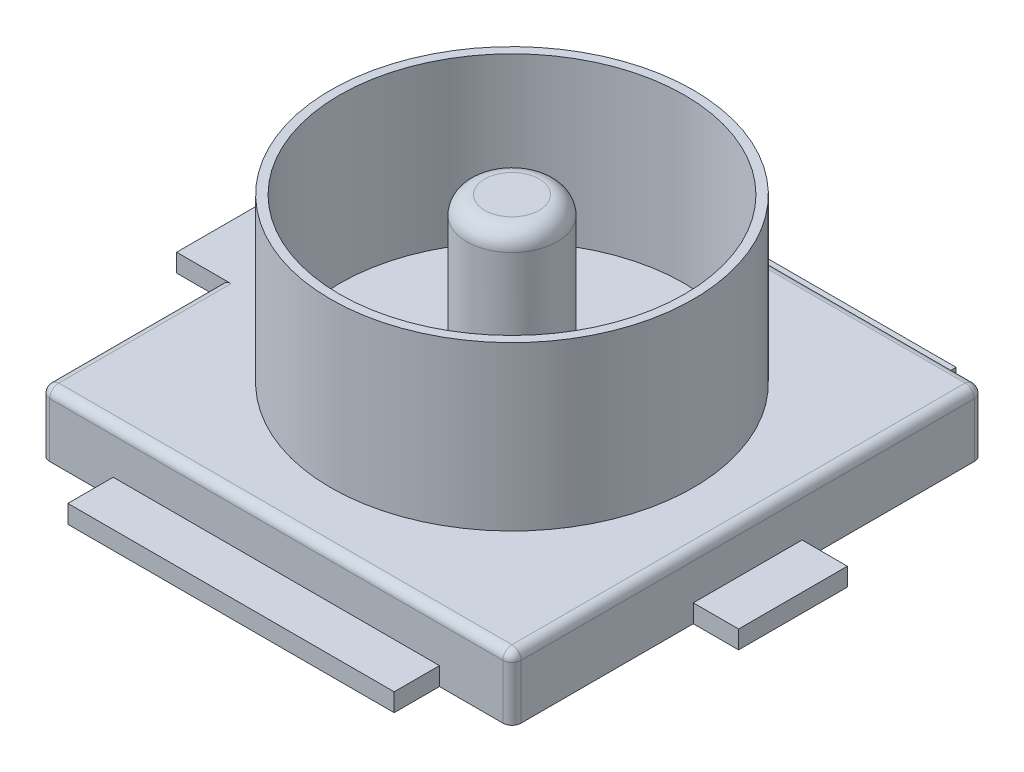
from build123d import *

# Parameters (mm, degrees)
SKETCH_1_W      = 2.6
SKETCH_1_H      = 2.6
EXTRUDE_1_DEPTH = 0.35
SKETCH_2_R      = 1
SKETCH_2_R_2    = 0.951541019
SKETCH_2_R_3    = 0.25
EXTRUDE_2_DEPTH = 0.9
SKETCH_3_W      = 0.6
SKETCH_3_H      = 0.1
EXTRUDE_3_DEPTH = 0.25
SKETCH_4_W      = 1.8
SKETCH_4_H      = 0.1
EXTRUDE_4_DEPTH = 0.25
SKETCH_5_W      = 1.8
SKETCH_5_H      = 0.1
EXTRUDE_5_DEPTH = 0.25
SKETCH_6_W      = 0.6
SKETCH_6_H      = 0.1
EXTRUDE_6_DEPTH = 0.25
FILLET_1_R      = 0.1
FILLET_2_R      = 0.05
FILLET_3_R      = 0.05


with BuildPart() as part:
    # 草图1 → 凸台-拉伸1 (new body)
    with BuildSketch(Plane(origin=(0, 0, 0), x_dir=(1, 0, 0), z_dir=(0, 1, 0))):
        with Locations((1.3, 1.3)):
            Rectangle(SKETCH_1_W, SKETCH_1_H)
    extrude(amount=EXTRUDE_1_DEPTH)

    # 草图2 → 凸台-拉伸2 (add)
    # profile 1 of 2: a face of its own
    with BuildSketch(Plane(origin=(0, 0.35, 0), x_dir=(1, 0, 0), z_dir=(0, 1, 0))):
        with Locations(Location((1.3, 1.3, 0), (0, 0, 90))):
            Circle(SKETCH_2_R)
        with Locations(Location((1.3, 1.3, 0), (0, 0, 270))):
            Circle(SKETCH_2_R_2, mode=Mode.SUBTRACT)
    # profile 2 of 2: a face of its own
    with BuildSketch(Plane(origin=(0, 0.35, 0), x_dir=(1, 0, 0), z_dir=(0, 1, 0))):
        with Locations(Location((1.3, 1.3, 0), (0, 0, 90))):
            Circle(SKETCH_2_R_3)
    extrude(amount=EXTRUDE_2_DEPTH)

    # 草图3 → 凸台-拉伸3 (add)
    with BuildSketch(Plane(origin=(2.6, 0, 0), x_dir=(0, 0, -1), z_dir=(1, 0, 0))):
        with Locations((1.3, 0.05)):
            Rectangle(SKETCH_3_W, SKETCH_3_H)
    extrude(amount=EXTRUDE_3_DEPTH)

    # 草图4 → 凸台-拉伸4 (add)
    with BuildSketch(Plane.XY):
        with Locations((1.3, 0.05)):
            Rectangle(SKETCH_4_W, SKETCH_4_H)
    extrude(amount=EXTRUDE_4_DEPTH)

    # 草图5 → 凸台-拉伸5 (add)
    with BuildSketch(Plane(origin=(0, 0, -2.6), x_dir=(-1, 0, 0), z_dir=(0, 0, -1))):
        with Locations((-1.3, 0.05)):
            Rectangle(SKETCH_5_W, SKETCH_5_H)
    extrude(amount=EXTRUDE_5_DEPTH)

    # 草图6 → 凸台-拉伸6 (add)
    with BuildSketch(Plane.ZY):
        with Locations((-1.3, 0.3)):
            Rectangle(SKETCH_6_W, SKETCH_6_H)
    extrude(amount=EXTRUDE_6_DEPTH)

    # 圆角1
    fillet_1_edges = [part.edges().sort_by_distance(p)[0] for p in [
        (1.3, 1.25, -1.05),
    ]]
    fillet(fillet_1_edges, radius=FILLET_1_R)

    # 圆角2
    fillet_2_edges = [part.edges().sort_by_distance(p)[0] for p in [
        (2.6, 0.35, -1.3),
        (1.3, 0.35, -2.6),
        (0, 0.35, -2.1),
        (0, 0.35, -0.5),
        (1.3, 0.35, 0),
    ]]
    fillet(fillet_2_edges, radius=FILLET_2_R)

    # 圆角3
    # the kernel refuses this fillet: 0.05 mm, written as the material it takes off along each edge
    with BuildSketch(Plane(origin=(0.05, 0.3, -2.55), x_dir=(0, 0, -1), z_dir=(-1, 0, 0))) as fillet_3_piece_1_section:
        Polygon((0, 0), (FILLET_3_R, 0), (FILLET_3_R, -FILLET_3_R), (0, -FILLET_3_R), align=None)
    fillet_3_piece_1 = extrude(amount=FILLET_3_R, mode=Mode.PRIVATE)
    fillet_3_piece_1 = fillet_3_piece_1 - Plane(origin=(0.05, 0.3, -2.55), x_dir=(0, -0.7071067811865475, 0.7071067811865475), z_dir=(-1, 0, 0)) * Sphere(FILLET_3_R, mode=Mode.PRIVATE)
    add(fillet_3_piece_1, mode=Mode.SUBTRACT)
    with BuildSketch(Plane(origin=(0.05, 0.3, -0.05), x_dir=(0, 0, 1), z_dir=(-1, 0, 0))) as fillet_3_piece_2_section:
        Polygon((0, 0), (FILLET_3_R, 0), (FILLET_3_R, FILLET_3_R), (0, FILLET_3_R), align=None)
    fillet_3_piece_2 = extrude(amount=FILLET_3_R, mode=Mode.PRIVATE)
    fillet_3_piece_2 = fillet_3_piece_2 - Plane(origin=(0.05, 0.3, -0.05), x_dir=(0, -0.7071067811865475, -0.7071067811865475), z_dir=(-1, 0, 0)) * Sphere(FILLET_3_R, mode=Mode.PRIVATE)
    add(fillet_3_piece_2, mode=Mode.SUBTRACT)
    with BuildSketch(Plane(origin=(2.55, 0.3, -0.05), x_dir=(0, 0, 1), z_dir=(1, 0, 0))) as fillet_3_piece_3_section:
        Polygon((0, 0), (FILLET_3_R, 0), (FILLET_3_R, -FILLET_3_R), (0, -FILLET_3_R), align=None)
    fillet_3_piece_3 = extrude(amount=FILLET_3_R, mode=Mode.PRIVATE)
    fillet_3_piece_3 = fillet_3_piece_3 - Plane(origin=(2.55, 0.3, -0.05), x_dir=(0, -0.7071067811865475, -0.7071067811865475), z_dir=(1, 0, 0)) * Sphere(FILLET_3_R, mode=Mode.PRIVATE)
    add(fillet_3_piece_3, mode=Mode.SUBTRACT)
    with BuildSketch(Plane(origin=(2.55, 0.3, -2.55), x_dir=(1, 0, 0), z_dir=(0, 0, -1))) as fillet_3_piece_4_section:
        Polygon((0, 0), (FILLET_3_R, 0), (FILLET_3_R, -FILLET_3_R), (0, -FILLET_3_R), align=None)
    fillet_3_piece_4 = extrude(amount=FILLET_3_R, mode=Mode.PRIVATE)
    fillet_3_piece_4 = fillet_3_piece_4 - Plane(origin=(2.55, 0.3, -2.55), x_dir=(-0.7071067811865475, -0.7071067811865475, 0), z_dir=(0, 0, -1)) * Sphere(FILLET_3_R, mode=Mode.PRIVATE)
    add(fillet_3_piece_4, mode=Mode.SUBTRACT)
    with BuildSketch(Plane(origin=(0, -0.125, -2.6), x_dir=(0, 0, 1), z_dir=(0, 1, 0)), Plane(origin=(2.6, -0.125, 0), x_dir=(0, 0, -1), z_dir=(0, 1, 0)), Plane(origin=(2.6, -0.125, -2.6), x_dir=(-1, 0, 0), z_dir=(0, 1, 0))) as fillet_3_piece_5:
        with BuildLine():
            CenterArc((FILLET_3_R, FILLET_3_R), FILLET_3_R, 180, 90)
            Line((0, FILLET_3_R), (0, 0))
            Line((0, 0), (FILLET_3_R, 0))
        make_face()
    extrude(amount=0.425, mode=Mode.SUBTRACT)
    with BuildSketch(Plane(origin=(0, -0.125, 0), x_dir=(0, 0, -1), z_dir=(0, 1, 0))) as fillet_3_piece_6:
        with BuildLine():
            CenterArc((FILLET_3_R, -FILLET_3_R), FILLET_3_R, 90, 90)
            Line((0, -FILLET_3_R), (0, 0))
            Line((0, 0), (FILLET_3_R, 0))
        make_face()
    extrude(amount=0.425, mode=Mode.SUBTRACT)


solid = part.part
